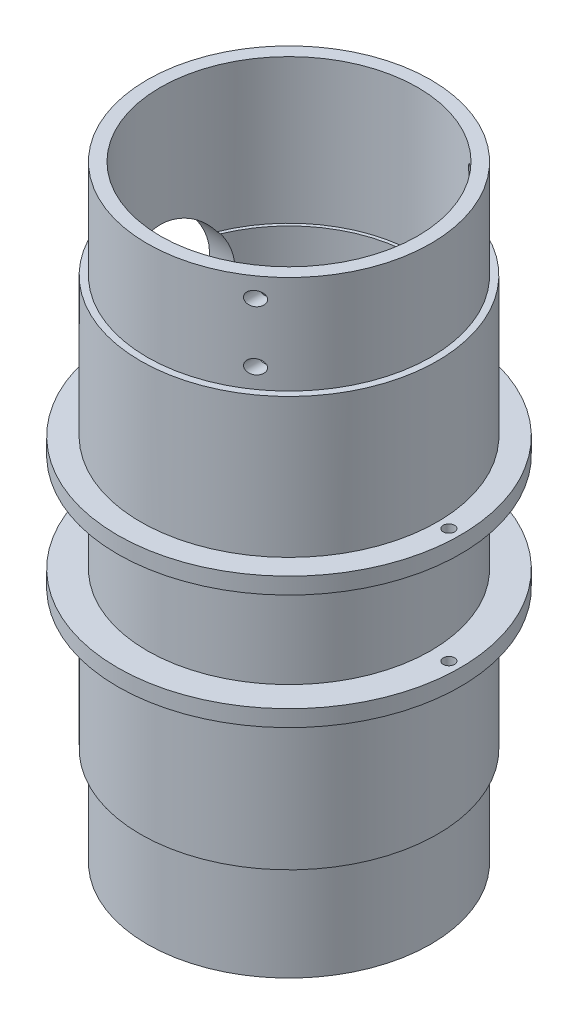
from build123d import *

# Parameters (mm, degrees)
SKETCH1_R                      = 45.25
SKETCH1_R_2                    = 38.25
BOSS_EXTRUDE1_DEPTH            = 92.5
BOSS_EXTRUDE2_START            = -6.35
SKETCH2_R                      = 38.25
SKETCH2_R_2                    = 36.25
BOSS_EXTRUDE2_DEPTH            = 100
CUT_EXTRUDE3_START             = -44
SKETCH6_R                      = 39.25
SKETCH6_R_2                    = 38.25
CUT_EXTRUDE3_DEPTH             = 44
SKETCH7_R                      = 17.5
CUT_EXTRUDE4_DEPTH             = 113.478331247
SKETCH8_R                      = 45.25
SKETCH8_R_2                    = 43.25
CUT_EXTRUDE5_DEPTH             = 30
SKETCH9_R                      = 45.25
SKETCH9_R_2                    = 43.25
CUT_EXTRUDE6_DEPTH             = 15
SKETCH10_R                     = 52.25
SKETCH10_R_2                   = 43.25
SKETCH10_R_3                   = 1.75
BOSS_EXTRUDE3_DEPTH            = 5
CBORE_FOR_M4_SHCS1_D           = 4.3
CBORE_FOR_M4_SHCS1_DEPTH       = 100.101198794
CBORE_FOR_M4_SHCS1_CBORE_D     = 8
CBORE_FOR_M4_SHCS1_CBORE_DEPTH = 4
CBORE_FOR_M4_SHCS1_TIP         = 1.291850331


with BuildPart() as part:
    # Sketch1 → Boss-Extrude1 (new, symmetric)
    with BuildSketch(Plane(origin=(0, 0, 0), x_dir=(1, 0, 0), z_dir=(0, 1, 0))):
        Circle(SKETCH1_R)
        Circle(SKETCH1_R_2, mode=Mode.SUBTRACT)
    extrude(amount=BOSS_EXTRUDE1_DEPTH, both=True)

    # Sketch2 → Boss-Extrude2 (add)
    with BuildSketch(Plane.XZ.offset(92.5).offset(BOSS_EXTRUDE2_START)):
        Circle(SKETCH2_R)
        Circle(SKETCH2_R_2, mode=Mode.SUBTRACT)
    extrude(amount=-BOSS_EXTRUDE2_DEPTH)

    # Sketch6 → Cut-Extrude3 (cut)
    with BuildSketch(Plane(origin=(0, 92.5, 0), x_dir=(1, 0, 0), z_dir=(0, 1, 0)).offset(CUT_EXTRUDE3_START)):
        Circle(SKETCH6_R)
        Circle(SKETCH6_R_2, mode=Mode.SUBTRACT)
    extrude(amount=CUT_EXTRUDE3_DEPTH, mode=Mode.SUBTRACT)

    # Sketch7 → Cut-Extrude4 (cut, through all)
    with BuildSketch(Plane(origin=(0, 0, 0), x_dir=(0, 0, -1), z_dir=(1, 0, 0))):
        with Locations((0, 38.75)):
            Circle(SKETCH7_R)
    extrude(amount=-CUT_EXTRUDE4_DEPTH, mode=Mode.SUBTRACT)

    # Sketch8 → Cut-Extrude5 (cut)
    with BuildSketch(Plane(origin=(0, 92.5, 0), x_dir=(1, 0, 0), z_dir=(0, 1, 0))):
        Circle(SKETCH8_R)
        Circle(SKETCH8_R_2, mode=Mode.SUBTRACT)
    cut_extrude5 = extrude(amount=-CUT_EXTRUDE5_DEPTH, mode=Mode.SUBTRACT)

    # Mirror1: Cut-Extrude5 across plane
    add(cut_extrude5.mirror(Plane.ZX), mode=Mode.SUBTRACT)

    # Sketch9 → Cut-Extrude6 (cut, symmetric)
    with BuildSketch(Plane(origin=(0, 0, 0), x_dir=(1, 0, 0), z_dir=(0, 1, 0))):
        Circle(SKETCH9_R)
        Circle(SKETCH9_R_2, mode=Mode.SUBTRACT)
    extrude(amount=CUT_EXTRUDE6_DEPTH, both=True, mode=Mode.SUBTRACT)

    # Sketch10 → Boss-Extrude3 (add)
    with BuildSketch(Plane(origin=(0, 15, 0), x_dir=(-1, 0, 0), z_dir=(0, -1, 0))):
        Circle(SKETCH10_R)
        Circle(SKETCH10_R_2, mode=Mode.SUBTRACT)
        with Locations((-48.75, 0)):
            Circle(SKETCH10_R_3, mode=Mode.SUBTRACT)
    boss_extrude3 = extrude(amount=-BOSS_EXTRUDE3_DEPTH)

    # Mirror2: Boss-Extrude3 across plane
    add(boss_extrude3.mirror(Plane.ZX))

    # CBORE for M4 SHCS1
    with Locations(Plane(origin=(632.558854999, 23.277998722, 50.050599397), x_dir=(-0.34672204965704834, 0.9379679207103063, 0), z_dir=(0, 0, 1))):
        with Locations((253.070838002, 554.191250959), (269.954260575, 547.950254066)):
            CounterBoreHole(CBORE_FOR_M4_SHCS1_D / 2, CBORE_FOR_M4_SHCS1_CBORE_D / 2, CBORE_FOR_M4_SHCS1_CBORE_DEPTH, depth=CBORE_FOR_M4_SHCS1_DEPTH)
            with Locations((0, 0, -(CBORE_FOR_M4_SHCS1_DEPTH + CBORE_FOR_M4_SHCS1_TIP / 2))):  # 118° drill point
                Cone(0, CBORE_FOR_M4_SHCS1_D / 2, CBORE_FOR_M4_SHCS1_TIP, mode=Mode.SUBTRACT)


solid = part.part
